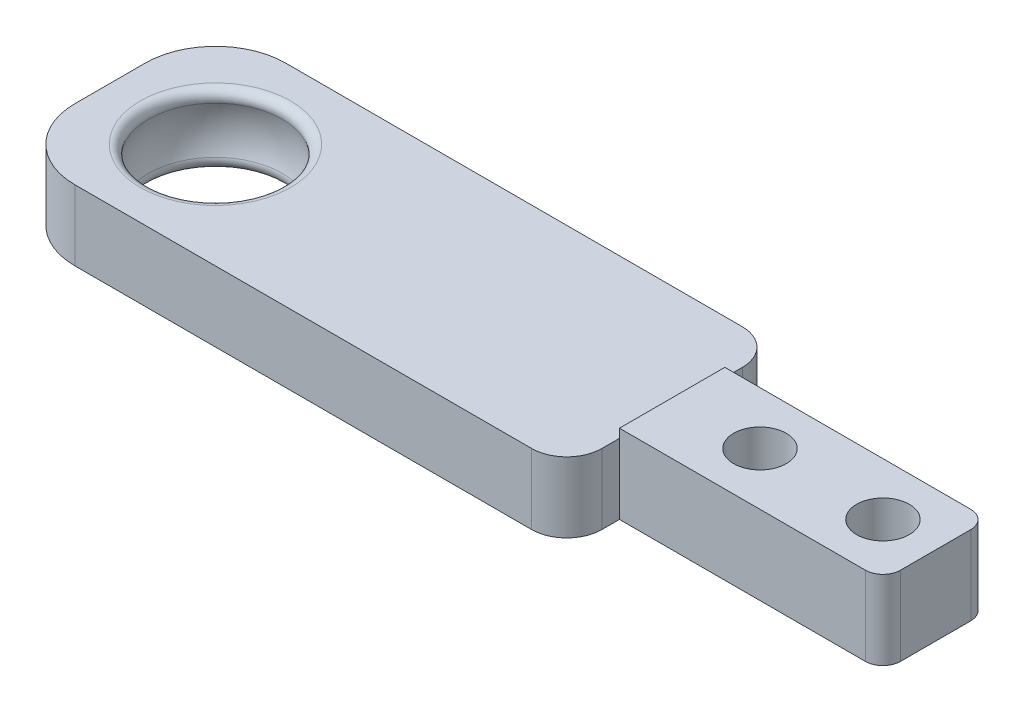
from build123d import *

# Parameters (mm, degrees)
SKETCH1_W           = 32
SKETCH1_H           = 12
BOSS_EXTRUDE1_DEPTH = 4
FILLET1_R           = 4
FILLET2_R           = 0.5
SKETCH3_W           = 6
SKETCH3_H           = 4
BOSS_EXTRUDE2_DEPTH = 15
SKETCH5_R           = 1.5
CUT_EXTRUDE1_DEPTH  = 32.827661054
BOSS_EXTRUDE3_START = 0.5
SKETCH6_W           = 15
SKETCH6_H           = 6
SKETCH6_R           = 1.5
BOSS_EXTRUDE3_DEPTH = 0.5
FILLET3_R           = 2
FILLET4_R           = 1


with BuildPart() as part:
    # Sketch1 → Boss-Extrude1 (new body)
    with BuildSketch(Plane(origin=(0, 0, 0), x_dir=(1, 0, 0), z_dir=(0, 1, 0))):
        Rectangle(SKETCH1_W, SKETCH1_H)
    extrude(amount=BOSS_EXTRUDE1_DEPTH)

    # Sketch2 → Cut-Revolve1 (revolve, cut)
    with BuildSketch(Plane.XY):
        with BuildLine():
            Line((-10, 4), (-10, 0))
            Line((-10, 0), (-13.5, 0))
            ThreePointArc((-13.5, 0), (-14.031128874, 2), (-13.5, 4))
            Line((-13.5, 4), (-10, 4))
        make_face()
    revolve(axis=Axis((-10, 4, 0), (0, -1, 0)), mode=Mode.SUBTRACT)

    # Fillet1
    fillet1_edges = [part.edges().sort_by_distance(p)[0] for p in [
        (-16, 2, -6),
        (-16, 2, 6),
    ]]
    fillet(fillet1_edges, radius=FILLET1_R)

    # Fillet2
    fillet2_edges = [part.edges().sort_by_distance(p)[0] for p in [
        (-6.5, 4, 0),
        (-6.5, 0, 0),
    ]]
    fillet(fillet2_edges, radius=FILLET2_R)

    # Sketch3 → Boss-Extrude2 (add)
    with BuildSketch(Plane(origin=(16, 0, 0), x_dir=(0, 0, -1), z_dir=(1, 0, 0))):
        with Locations((0, 2)):
            Rectangle(SKETCH3_W, SKETCH3_H)
    extrude(amount=BOSS_EXTRUDE2_DEPTH)

    # Sketch5 → Cut-Extrude1 (cut, through all)
    with BuildSketch(Plane(origin=(0, 4, 0), x_dir=(1, 0, 0), z_dir=(0, 1, 0))):
        with Locations((21, 0)):
            Circle(SKETCH5_R)
        with Locations((28, 0)):
            Circle(SKETCH5_R)
    extrude(amount=-CUT_EXTRUDE1_DEPTH, mode=Mode.SUBTRACT)

    # Sketch6 → Boss-Extrude3 (add)
    with BuildSketch(Plane(origin=(0, 4, 0), x_dir=(1, 0, 0), z_dir=(0, 1, 0)).offset(BOSS_EXTRUDE3_START)):
        with Locations((23.5, 0)):
            Rectangle(SKETCH6_W, SKETCH6_H)
        with Locations((21, 0)):
            Circle(SKETCH6_R, mode=Mode.SUBTRACT)
        with Locations((28, 0)):
            Circle(SKETCH6_R, mode=Mode.SUBTRACT)
    extrude(amount=-BOSS_EXTRUDE3_DEPTH)

    # Fillet3
    fillet3_edges = [part.edges().sort_by_distance(p)[0] for p in [
        (16, 2, 6),
        (16, 2, -6),
    ]]
    fillet(fillet3_edges, radius=FILLET3_R)

    # Fillet4
    fillet4_edges = [part.edges().sort_by_distance(p)[0] for p in [
        (31, 2.25, 3),
        (31, 2.25, -3),
    ]]
    fillet(fillet4_edges, radius=FILLET4_R)


solid = part.part
